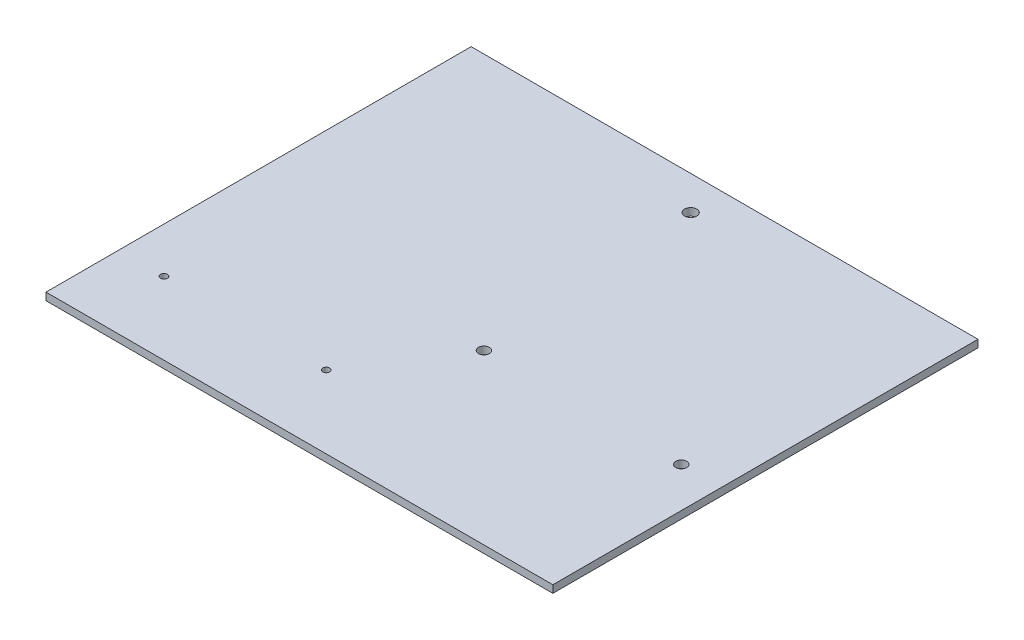
from build123d import *

# Parameters (mm, degrees)
SKETCH1_W               = 189.738
SKETCH1_H               = 184.15
BOSS_EXTRUDE1_DEPTH     = 2.794
SKETCH2_R               = 2.286
CUT_EXTRUDE1_DEPTH      = 133.233653893
CUT_EXTRUDE2_DEPTH      = 133.233653893
CUT_EXTRUDE4_DEPTH      = 133.233653893
CUT_EXTRUDE4_DEPTH_BACK = 133.233653893
SKETCH4_R               = 1.3
SKETCH4_R_2             = 2.038700012


with BuildPart() as part:
    # Sketch1 → Boss-Extrude1 (new body)
    with BuildSketch(Plane(origin=(0, 0, 0), x_dir=(1, 0, 0), z_dir=(0, 1, 0))):
        Rectangle(SKETCH1_W, SKETCH1_H)
    extrude(amount=BOSS_EXTRUDE1_DEPTH)

    # Sketch2 → Cut-Extrude1 (cut, through all)
    with BuildSketch(Plane(origin=(0, 2.794, 0), x_dir=(1, 0, 0), z_dir=(0, 1, 0))):
        with Locations((0, 79.375)):
            Circle(SKETCH2_R)
    extrude(amount=-CUT_EXTRUDE1_DEPTH, mode=Mode.SUBTRACT)

    # Sketch3 → Cut-Extrude2 (cut, through all)
    with BuildSketch(Plane(origin=(0, 2.794, 0), x_dir=(1, 0, 0), z_dir=(0, 1, 0))):
        Polygon((0, -92.075), (-94.869, -92.075), (-94.869, -67.074999962), (94.869, -67.074999962), (94.869, -92.075), align=None)
    extrude(amount=-CUT_EXTRUDE2_DEPTH, mode=Mode.SUBTRACT)

    # Sketch4 → Cut-Extrude4 (cut, two sides: drawn at the far end of the back side and taken through both)
    with BuildSketch(Plane(origin=(0, 2.794, 0), x_dir=(1, 0, 0), z_dir=(0, 1, 0)).offset(-CUT_EXTRUDE4_DEPTH_BACK)):
        with Locations((-77.889, -39.874999962)):
            Circle(SKETCH4_R)
        with Locations((-17.183, -39.874999962)):
            Circle(SKETCH4_R)
        with Locations((79.894, -4.039999962)):
            Circle(SKETCH4_R_2)
        with Locations((6.014, -4.039999962)):
            Circle(SKETCH4_R_2)
    extrude(amount=CUT_EXTRUDE4_DEPTH + CUT_EXTRUDE4_DEPTH_BACK, mode=Mode.SUBTRACT)


solid = part.part
